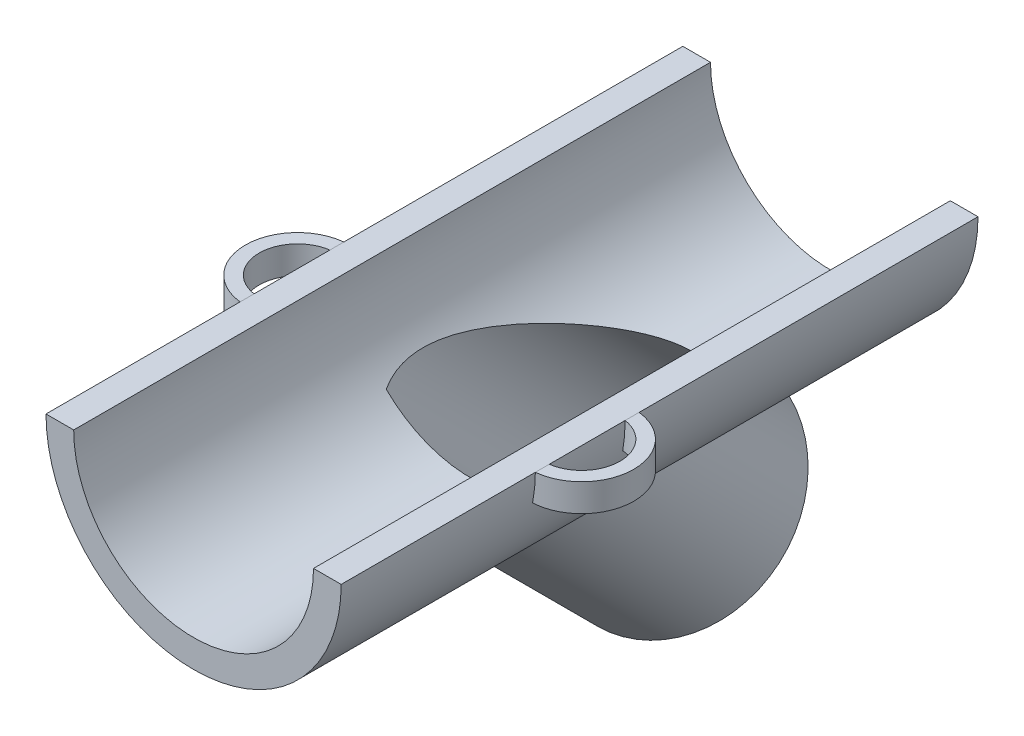
from build123d import *

# Parameters (mm, degrees)
BOSS_EXTRUDE1_DEPTH      = 76.2
BOSS_EXTRUDE4_REACH      = 80.569
BOSS_EXTRUDE4_END_RADIUS = 13.54
SKETCH4_R                = 10
CUT_EXTRUDE4_DEPTH       = 94.242153775
CUT_EXTRUDE4_DEPTH_BACK  = 94.242153775
SKETCH9_R                = 8.5
CUT_EXTRUDE5_DEPTH       = 43.18
BOSS_EXTRUDE5_DEPTH      = 25.4
BOSS_EXTRUDE6_DEPTH      = 2.54
BOSS_EXTRUDE6_2_DEPTH    = 2.54
SKETCH14_R               = 10
CUT_EXTRUDE6_DEPTH       = 25.4


with BuildPart() as part:
    # Sketch2 → Boss-Extrude1 (new body)
    with BuildSketch(Plane.XY):
        with BuildLine():
            Line((13.54, 0), (11, 0))
            ThreePointArc((11, 0), (0, -11), (-11, 0))
            Line((-11, 0), (-13.54, 0))
            ThreePointArc((-13.54, 0), (0, -13.54), (13.54, 0))
        make_face()
    extrude(amount=BOSS_EXTRUDE1_DEPTH)

    # Boss-Extrude4: up to this cylinder (the profile starts outside it)
    boss_extrude4_end = Plane(origin=(0, 0, 39.513127), z_dir=(0, 0, -1)) * Cylinder(BOSS_EXTRUDE4_END_RADIUS, 189.218, mode=Mode.PRIVATE)
    # Sketch4 → Boss-Extrude4 (add, up to the surface)
    with BuildSketch(Plane(origin=(0, 0, 0), x_dir=(-1, 0, 0), z_dir=(0, 0.7071067811865561, 0.7071067811865389)), mode=Mode.PRIVATE) as boss_extrude4_sk1:
        with Locations((0, 55.88)):
            Circle(SKETCH4_R)
    boss_extrude4_tool1 = extrude(boss_extrude4_sk1.sketch, amount=BOSS_EXTRUDE4_REACH, mode=Mode.PRIVATE) - boss_extrude4_end
    add(boss_extrude4_tool1.solids().sort_by_distance((0, -39.513127, 39.513127))[0])

    # Sketch9 → Cut-Extrude4 (cut, two sides: drawn at the far end of the back side and taken through both)
    with BuildSketch(Plane(origin=(0, 0, 0), x_dir=(-1, 0, 0), z_dir=(0, -0.7071067811865562, -0.7071067811865389)).offset(-CUT_EXTRUDE4_DEPTH_BACK)):
        with Locations((0, -55.88)):
            Circle(SKETCH9_R)
    extrude(amount=CUT_EXTRUDE4_DEPTH + CUT_EXTRUDE4_DEPTH_BACK, mode=Mode.SUBTRACT)

    # Sketch10 → Cut-Extrude5 (cut)
    with BuildSketch(Plane(origin=(0, 0, 0), x_dir=(-1, 0, 0), z_dir=(0, 0, -1))):
        with BuildLine():
            Line((13.54, 0), (11, 0))
            ThreePointArc((11, 0), (0, -11), (-11, 0))
            Line((-11, 0), (-13.54, 0))
            ThreePointArc((-13.54, 0), (0, -13.54), (13.54, 0))
        make_face()
    extrude(amount=-CUT_EXTRUDE5_DEPTH, mode=Mode.SUBTRACT)

    # Sketch11 → Boss-Extrude5 (add)
    with BuildSketch(Plane.XY.offset(76.2)):
        with BuildLine():
            Line((13.54, 0), (11, 0))
            ThreePointArc((11, 0), (0, -11), (-11, 0))
            Line((-11, 0), (-13.54, 0))
            ThreePointArc((-13.54, 0), (0, -13.54), (13.54, 0))
        make_face()
    extrude(amount=BOSS_EXTRUDE5_DEPTH)

    # Sketch14 → Cut-Extrude6 (cut)
    with BuildSketch(Plane(origin=(0, 0, 0), x_dir=(1, 0, 0), z_dir=(0, -0.7071067811865562, -0.7071067811865389))):
        with Locations((0, 55.88)):
            Circle(SKETCH14_R)
    extrude(amount=-CUT_EXTRUDE6_DEPTH, mode=Mode.SUBTRACT)


with BuildPart() as body_2:
    # Sketch12 → Boss-Extrude6 (new body)
    with BuildSketch(Plane(origin=(0, 0, 0), x_dir=(1, 0, 0), z_dir=(0, 1, 0))):
        with BuildLine():
            Line((-13.032, -83.82), (-13.032, -82.55))
            ThreePointArc((-13.032, -82.55), (-16.54899091, -79.03300909), (-13.032, -75.51601818))
            Line((-13.032, -75.51601818), (-13.032, -74.24601818))
            ThreePointArc((-13.032, -74.24601818), (-17.81899091, -79.03300909), (-13.032, -83.82))
        make_face()
    extrude(amount=-BOSS_EXTRUDE6_DEPTH)


with BuildPart() as body_3:
    # Sketch12 → Boss-Extrude6 2 (new body)
    with BuildSketch(Plane(origin=(0, 0, 0), x_dir=(1, 0, 0), z_dir=(0, 1, 0))):
        with BuildLine():
            Line((13.032, -74.24601818), (13.032, -75.51601818))
            ThreePointArc((13.032, -75.51601818), (16.54899091, -79.03300909), (13.032, -82.55))
            Line((13.032, -82.55), (13.032, -83.82))
            ThreePointArc((13.032, -83.82), (17.81899091, -79.03300909), (13.032, -74.24601818))
        make_face()
    extrude(amount=-BOSS_EXTRUDE6_2_DEPTH)


solid = Compound([part.part, body_2.part, body_3.part])
